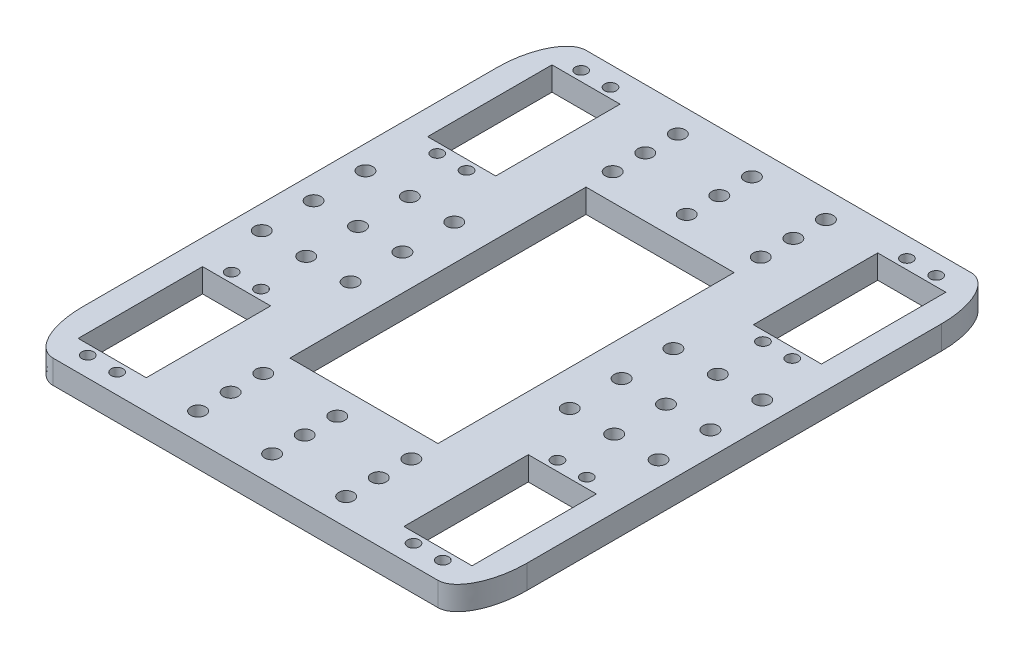
from build123d import *

# Parameters (mm, degrees)
SKETCH2_W               = 150
SKETCH2_H               = 180
BOSS_EXTRUDE1_DEPTH     = 4
SKETCH3_R               = 2
SKETCH3_W               = 23
SKETCH3_H               = 42
CUT_EXTRUDE1_DEPTH      = 118.426572802
MIRROR2_COPY_1_SKETCH_R = 2
MIRROR2_COPY_1_SKETCH_W = 23
MIRROR2_COPY_1_SKETCH_H = 42
MIRROR2_COPY_1_DEPTH    = 118.426572802
FILLET1_SIZE            = 10
FILLET1_SIZE_2          = 20
FILLET2_SIZE            = 10
FILLET2_SIZE_2          = 20
SKETCH4_W               = 50
SKETCH4_H               = 100
CUT_EXTRUDE2_DEPTH      = 118.426572949
SKETCH5_R               = 2.5
CUT_EXTRUDE3_DEPTH      = 118.426572949
SKETCH6_R               = 2.5
CUT_EXTRUDE4_DEPTH      = 118.426572949


with BuildPart() as part:
    # Sketch2 → Boss-Extrude1 (new, symmetric)
    with BuildSketch(Plane(origin=(0, 0, 0), x_dir=(1, 0, 0), z_dir=(0, 1, 0))):
        Rectangle(SKETCH2_W, SKETCH2_H)
    extrude(amount=BOSS_EXTRUDE1_DEPTH, both=True)

    # Sketch3 → Cut-Extrude1 (cut, through all)
    with BuildSketch(Plane(origin=(0, 4, 0), x_dir=(1, 0, 0), z_dir=(0, 1, 0))):
        with Locations(Location((-59.95, -34.7, 0), (0, 0, 270))):
            Circle(SKETCH3_R)
        with Locations(Location((-50.05, -34.7, 0), (0, 0, 270))):
            Circle(SKETCH3_R)
        with Locations(Location((-59.95, -83.3, 0), (0, 0, 270))):
            Circle(SKETCH3_R)
        with Locations(Location((-50.05, -83.3, 0), (0, 0, 270))):
            Circle(SKETCH3_R)
        with Locations((-55, -59)):
            Rectangle(SKETCH3_W, SKETCH3_H)
    cut_extrude1 = extrude(amount=-CUT_EXTRUDE1_DEPTH, mode=Mode.SUBTRACT)

    # Mirror1: Cut-Extrude1 across plane
    add(cut_extrude1.mirror(Plane.XY), mode=Mode.SUBTRACT)

    # Mirror2: Cut-Extrude1 across plane
    add(cut_extrude1.mirror(Plane(origin=(0, 0, 0), x_dir=(0, 0, 1), z_dir=(1, 0, 0))), mode=Mode.SUBTRACT)

    # Mirror2 copy 1 sketch → Mirror2 copy 1 (cut, through all)
    with BuildSketch(Plane(origin=(0, 4, 0), x_dir=(-1, 0, 0), z_dir=(0, 1, 0))):
        with Locations(Location((-59.95, -34.7, 0), (0, 0, 270))):
            Circle(MIRROR2_COPY_1_SKETCH_R)
        with Locations(Location((-50.05, -34.7, 0), (0, 0, 270))):
            Circle(MIRROR2_COPY_1_SKETCH_R)
        with Locations(Location((-59.95, -83.3, 0), (0, 0, 270))):
            Circle(MIRROR2_COPY_1_SKETCH_R)
        with Locations(Location((-50.05, -83.3, 0), (0, 0, 270))):
            Circle(MIRROR2_COPY_1_SKETCH_R)
        with Locations((-55, -59)):
            Rectangle(MIRROR2_COPY_1_SKETCH_W, MIRROR2_COPY_1_SKETCH_H)
    extrude(amount=-MIRROR2_COPY_1_DEPTH, mode=Mode.SUBTRACT)

    # Fillet1
    # an asymmetric fillet: 20, 10 mm, written as the material it takes off along each edge
    with BuildSketch(Plane(origin=(-75, -54, -90), x_dir=(1, 0, 0), z_dir=(0, 1, 0))) as fillet1_piece_1:
        with BuildLine():
            Bezier((FILLET1_SIZE, 0), (0, 0), (0, -FILLET1_SIZE_2), weights=[1, 0.707106781, 1])
            Line((0, -FILLET1_SIZE_2), (0, 0))
            Line((0, 0), (FILLET1_SIZE, 0))
        make_face()
    extrude(amount=108, mode=Mode.SUBTRACT)
    with BuildSketch(Plane(origin=(75, 54, 90), x_dir=(0, 0, -1), z_dir=(0, -1, 0))) as fillet1_piece_2:
        with BuildLine():
            Bezier((FILLET1_SIZE_2, 0), (0, 0), (0, -FILLET1_SIZE), weights=[1, 0.707106781, 1])
            Line((0, -FILLET1_SIZE), (0, 0))
            Line((0, 0), (FILLET1_SIZE_2, 0))
        make_face()
    extrude(amount=108, mode=Mode.SUBTRACT)

    # Fillet2
    # an asymmetric fillet: 20, 10 mm, written as the material it takes off along each edge
    with BuildSketch(Plane(origin=(75, 54, -90), x_dir=(-1, 0, 0), z_dir=(0, -1, 0))) as fillet2_piece_1:
        with BuildLine():
            Bezier((FILLET2_SIZE, 0), (0, 0), (0, -FILLET2_SIZE_2), weights=[1, 0.707106781, 1])
            Line((0, -FILLET2_SIZE_2), (0, 0))
            Line((0, 0), (FILLET2_SIZE, 0))
        make_face()
    extrude(amount=108, mode=Mode.SUBTRACT)
    with BuildSketch(Plane(origin=(-75, -54, 90), x_dir=(0, 0, -1), z_dir=(0, 1, 0))) as fillet2_piece_2:
        with BuildLine():
            Bezier((FILLET2_SIZE_2, 0), (0, 0), (0, -FILLET2_SIZE), weights=[1, 0.707106781, 1])
            Line((0, -FILLET2_SIZE), (0, 0))
            Line((0, 0), (FILLET2_SIZE_2, 0))
        make_face()
    extrude(amount=108, mode=Mode.SUBTRACT)

    # Sketch4 → Cut-Extrude2 (cut, through all)
    with BuildSketch(Plane(origin=(0, 4, 0), x_dir=(1, 0, 0), z_dir=(0, 1, 0))):
        Rectangle(SKETCH4_W, SKETCH4_H)
    extrude(amount=-CUT_EXTRUDE2_DEPTH, mode=Mode.SUBTRACT)

    # Sketch5 → Cut-Extrude3 (cut, through all)
    with BuildSketch(Plane(origin=(0, 4, 0), x_dir=(1, 0, 0), z_dir=(0, 1, 0))):
        with Locations(Location((-25, 81, 0), (0, 0, 270))):
            Circle(SKETCH5_R)
        with Locations(Location((25, 81, 0), (0, 0, 270))):
            Circle(SKETCH5_R)
        with Locations(Location((0, 81, 0), (0, 0, 270))):
            Circle(SKETCH5_R)
        with Locations(Location((-25, 70, 0), (0, 0, 270))):
            Circle(SKETCH5_R)
        with Locations(Location((0, 70, 0), (0, 0, 270))):
            Circle(SKETCH5_R)
        with Locations(Location((25, 70, 0), (0, 0, 270))):
            Circle(SKETCH5_R)
        with Locations(Location((-25, 59, 0), (0, 0, 270))):
            Circle(SKETCH5_R)
        with Locations(Location((0, 59, 0), (0, 0, 270))):
            Circle(SKETCH5_R)
        with Locations(Location((25, 59, 0), (0, 0, 270))):
            Circle(SKETCH5_R)
    cut_extrude3 = extrude(amount=-CUT_EXTRUDE3_DEPTH, mode=Mode.SUBTRACT)

    # Sketch6 → Cut-Extrude4 (cut, through all)
    with BuildSketch(Plane(origin=(0, 4, 0), x_dir=(1, 0, 0), z_dir=(0, 1, 0))):
        with Locations(Location((-67, 17.5, 0), (0, 0, 270))):
            Circle(SKETCH6_R)
        with Locations(Location((-67, -17.5, 0), (0, 0, 270))):
            Circle(SKETCH6_R)
        with Locations(Location((-67, 0, 0), (0, 0, 270))):
            Circle(SKETCH6_R)
        with Locations(Location((-52, 0, 0), (0, 0, 270))):
            Circle(SKETCH6_R)
        with Locations(Location((-52, 17.5, 0), (0, 0, 270))):
            Circle(SKETCH6_R)
        with Locations(Location((-52, -17.5, 0), (0, 0, 270))):
            Circle(SKETCH6_R)
        with Locations(Location((-37, 0, 0), (0, 0, 270))):
            Circle(SKETCH6_R)
        with Locations(Location((-37, 17.5, 0), (0, 0, 270))):
            Circle(SKETCH6_R)
        with Locations(Location((-37, -17.5, 0), (0, 0, 270))):
            Circle(SKETCH6_R)
    cut_extrude4 = extrude(amount=-CUT_EXTRUDE4_DEPTH, mode=Mode.SUBTRACT)

    # Mirror4: Cut-Extrude4 across plane
    add(cut_extrude4.mirror(Plane(origin=(0, 0, 0), x_dir=(0, 0, 1), z_dir=(1, 0, 0))), mode=Mode.SUBTRACT)

    # Mirror5: Cut-Extrude3 across plane
    add(cut_extrude3.mirror(Plane.XY), mode=Mode.SUBTRACT)


solid = part.part
